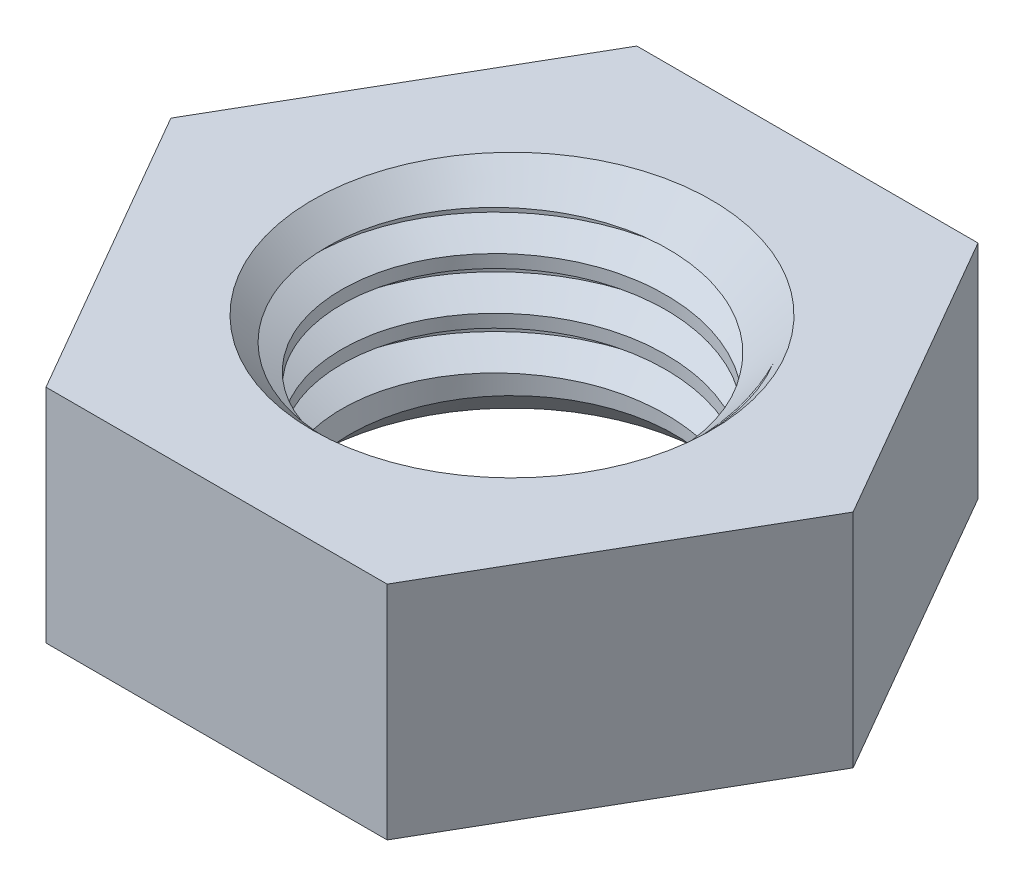
from build123d import *

# Parameters (mm, degrees)
SKETCH2_R           = 2.2
BOSS_EXTRUDE1_DEPTH = 3
CHAMFER1_SIZE       = 0.5
THREAD1_PITCH       = 0.7


with BuildPart() as part:
    # Sketch2 → Boss-Extrude1 (new body)
    with BuildSketch(Plane(origin=(0, 0, 0), x_dir=(1, 0, 0), z_dir=(0, 1, 0))):
        Polygon((4.618802154, 0), (2.309401077, 4), (-2.309401077, 4), (-4.618802154, 0), (-2.309401077, -4), (2.309401077, -4), align=None)
        with Locations(Location((0, 0, 0), (0, 0, 270))):
            Circle(SKETCH2_R, mode=Mode.SUBTRACT)
    extrude(amount=BOSS_EXTRUDE1_DEPTH)

    # Chamfer1
    chamfer1_edges = [part.edges().sort_by_distance(p)[0] for p in [
        (0, 0, -2.2),
        (0, 3, -2.2),
    ]]
    chamfer(chamfer1_edges, length=CHAMFER1_SIZE)

    # Thread1: the profile of Thread Profile1 profile screwed along a right-hand helix of 5.714286 turns, 6 arcs to a turn; built about Z, then put on its axis
    thread1_z = Axis((0, 0, 0), (0, 0, 1))
    thread1_corners = [(2.1997, 0, -0.000173205), (2.578886113, 0, 0.218749999), (2.578886113, 0, 0.306249999), (2.1997, 0, 0.525173203)]
    with BuildLine(mode=Mode.PRIVATE) as thread1_profile:
        Line(thread1_corners[0], thread1_corners[1])
        Line(thread1_corners[1], thread1_corners[2])
        Line(thread1_corners[2], thread1_corners[3])
        Line(thread1_corners[3], thread1_corners[0])
    thread1_cap = Face(thread1_profile.wire())
    thread1_turn_angles = [0, 30, 60, 90, 120, 150, 180, 210, 240, 270, 300, 330, 360]
    thread1_turn_weights = [1, 0.8660254037844387, 1, 0.8660254037844387, 1, 0.8660254037844387, 1, 0.8660254037844387, 1, 0.8660254037844387, 1, 0.8660254037844387, 1]
    thread1_turn_rails = [Edge.make_bspline([Vector(p[0], p[1], 0).rotate(thread1_z, thread1_turn_angles[k]) / thread1_turn_weights[k] + Vector(0, 0, p[2] + THREAD1_PITCH * thread1_turn_angles[k] / 360) for k in range(13)], [0, 0, 0, 1, 1, 2, 2, 3, 3, 4, 4, 5, 5, 6, 6, 6], 2, thread1_turn_weights) for p in thread1_corners]
    thread1_turn_sides = [Face.make_surface_from_curves(thread1_turn_rails[p[0]], thread1_turn_rails[p[1]]) for p in [(0, 1), (1, 2), (2, 3), (3, 0)]]
    thread1_last_angles = [1800, 1830, 1860, 1890, 1920, 1950, 1980, 2010, 2040, 2048.571428571, 2057.142857143]
    thread1_last_weights = [1, 0.8660254037844387, 1, 0.8660254037844387, 1, 0.8660254037844387, 1, 0.8660254037844387, 1, 0.9888308262251283, 1]
    thread1_last_rails = [Edge.make_bspline([Vector(p[0], p[1], 0).rotate(thread1_z, thread1_last_angles[k]) / thread1_last_weights[k] + Vector(0, 0, p[2] + THREAD1_PITCH * thread1_last_angles[k] / 360) for k in range(11)], [0, 0, 0, 1, 1, 2, 2, 3, 3, 4, 4, 5, 5, 5], 2, thread1_last_weights) for p in thread1_corners]
    thread1_last_sides = [Face.make_surface_from_curves(thread1_last_rails[p[0]], thread1_last_rails[p[1]]) for p in [(0, 1), (1, 2), (2, 3), (3, 0)]]
    thread1 = Plane(origin=(0, 0.5, 0), x_dir=(1, 0, 0), z_dir=(0, 1, 0)) * Solid(Shell([*[p.moved(Location((0, 0, THREAD1_PITCH * i))) for i in range(5) for p in thread1_turn_sides], *thread1_last_sides, thread1_cap, thread1_cap.rotate(thread1_z, 2057.142857143).moved(Location((0, 0, THREAD1_PITCH * 2057.142857143 / 360)))]))
    add(thread1, mode=Mode.SUBTRACT)


solid = part.part
